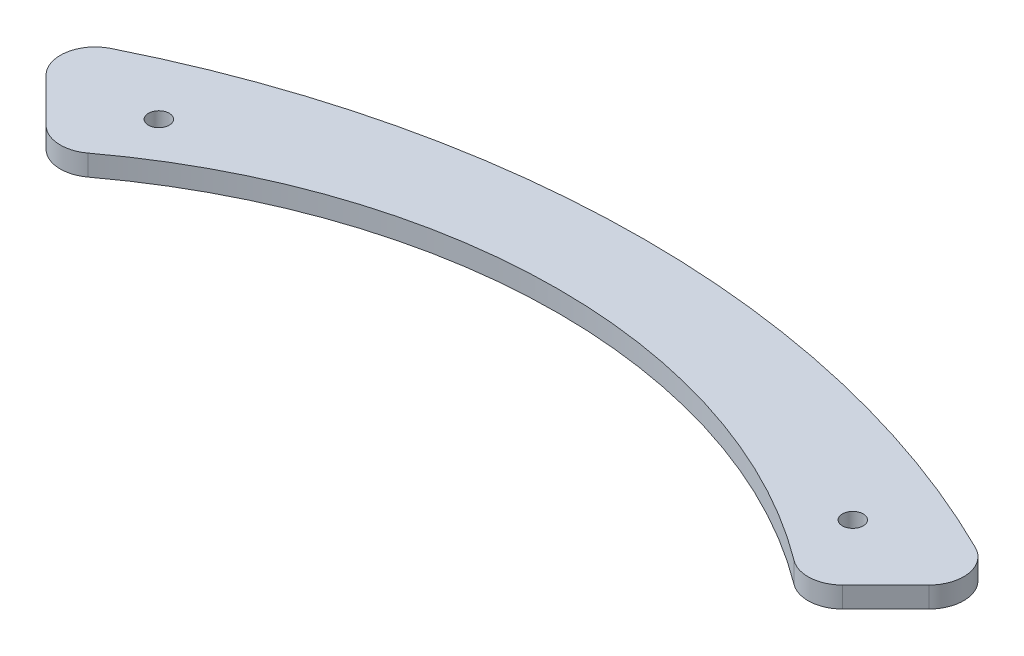
from build123d import *

# Parameters (mm, degrees)
BOSS_EXTRUDE1_DEPTH = 3
FILLET1_R           = 5
CUT_EXTRUDE1_REACH  = 156.417
SKETCH2_R           = 1.5


with BuildPart() as part:
    # Sketch1 → Boss-Extrude1 (new body)
    with BuildSketch(Plane(origin=(0, 0, 0), x_dir=(1, 0, 0), z_dir=(0, 1, 0))):
        with BuildLine():
            Line((-68.408481347, 122.148596717), (-54.266345723, 108.006461093))
            ThreePointArc((-54.266345723, 108.006461093), (0, 127.583500889), (54.266345723, 108.006461093))
            Line((54.266345723, 108.006461093), (68.408481347, 122.148596717))
            ThreePointArc((68.408481347, 122.148596717), (0, 140), (-68.408481347, 122.148596717))
        make_face()
    extrude(amount=BOSS_EXTRUDE1_DEPTH)

    # Fillet1
    fillet1_edges = [part.edges().sort_by_distance(p)[0] for p in [
        (68.408481347, 1.5, -122.148596717),
        (54.266345723, 1.5, -108.006461093),
        (-68.408481347, 1.5, -122.148596717),
        (-54.266345723, 1.5, -108.006461093),
    ]]
    fillet(fillet1_edges, radius=FILLET1_R)

    # Sketch2 → Cut-Extrude1 (cut, up to next)
    with BuildSketch(Plane(origin=(0, 3, 0), x_dir=(1, 0, 0), z_dir=(0, 1, 0)), mode=Mode.PRIVATE) as cut_extrude1_sk1:
        with Locations((-50, 120)):
            Circle(SKETCH2_R)
    cut_extrude1_tool1 = extrude(cut_extrude1_sk1.sketch, amount=-CUT_EXTRUDE1_REACH, mode=Mode.PRIVATE) & part.part
    # Sketch2 → Cut-Extrude1 (cut, up to next)
    with BuildSketch(Plane(origin=(0, 3, 0), x_dir=(1, 0, 0), z_dir=(0, 1, 0)), mode=Mode.PRIVATE) as cut_extrude1_sk2:
        with Locations((50, 120)):
            Circle(SKETCH2_R)
    cut_extrude1_tool2 = extrude(cut_extrude1_sk2.sketch, amount=-CUT_EXTRUDE1_REACH, mode=Mode.PRIVATE) & part.part
    add(cut_extrude1_tool1.solids().sort_by_distance((-50, 3, -120))[0], mode=Mode.SUBTRACT)
    add(cut_extrude1_tool2.solids().sort_by_distance((50, 3, -120))[0], mode=Mode.SUBTRACT)


solid = part.part
